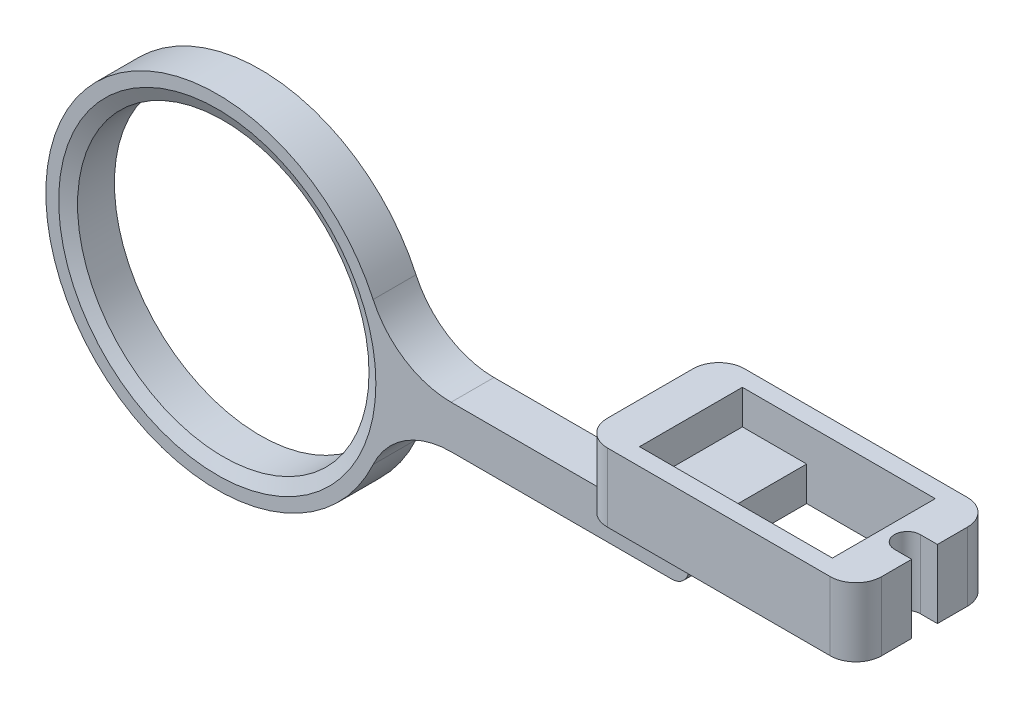
from build123d import *
from build123d.topology import SkipClean

# Parameters (mm, degrees)
BOSS_EXTRUDE1_DEPTH = 5
CHAMFER2_SIZE       = 1.5
CHAMFER2_SIZE2      = 0.699461487
FILLET1_R           = 10
SKETCH10_W          = 32
SKETCH10_H          = 5
BOSS_EXTRUDE3_DEPTH = 2
SKETCH5_W           = 32
SKETCH5_H           = 16
BOSS_EXTRUDE2_DEPTH = 8
SKETCH6_W           = 22.5
SKETCH6_H           = 12
CUT_EXTRUDE1_DEPTH  = 4
SKETCH7_W           = 25
SKETCH7_H           = 5
CUT_EXTRUDE2_DEPTH  = 7
SKETCH8_W           = 15
SKETCH8_H           = 12
CUT_EXTRUDE3_DEPTH  = 86.571607441
CUT_EXTRUDE4_DEPTH  = 85.32378075
FILLET2_R           = 2
FILLET3_START       = 48
FILLET3_DEPTH       = 6.9999999
FILLET3_START_2     = 47.322875556
FILLET3_2_DEPTH     = 9.677124544
FILLET3_START_3     = -3
FILLET3_3_DEPTH     = 10
FILLET4_R           = 3


with BuildPart() as part:
    # Sketch1 → Boss-Extrude1 (new body)
    with BuildSketch(Plane.XY):
        with BuildLine():
            ThreePointArc((16.815171721, -2.5), (-17, 0), (16.815171721, 2.5))
            Line((16.815171721, 2.5), (19.843134833, 2.5))
            ThreePointArc((19.843134833, 2.5), (-20, 0), (19.843134833, -2.5))
            Line((19.843134833, -2.5), (16.815171721, -2.5))
        make_face()
        with BuildLine():
            Line((19.843134833, 2.5), (16.815171721, 2.5))
            ThreePointArc((16.815171721, 2.5), (16.953729962, 1.253411494), (17, 0))
            ThreePointArc((17, 0), (16.953729962, -1.253411494), (16.815171721, -2.5))
            Line((16.815171721, -2.5), (19.843134833, -2.5))
            ThreePointArc((19.843134833, -2.5), (19.960745185, -1.252458251), (20, 0))
            ThreePointArc((20, 0), (19.960745185, 1.252458251), (19.843134833, 2.5))
        make_face()
        with BuildLine():
            Line((80, 2.5), (19.843134833, 2.5))
            ThreePointArc((19.843134833, 2.5), (19.960745185, 1.252458251), (20, 0))
            ThreePointArc((20, 0), (19.960745185, -1.252458251), (19.843134833, -2.5))
            Line((19.843134833, -2.5), (80, -2.5))
            Line((80, -2.5), (80, 2.5))
        make_face()
    extrude(amount=BOSS_EXTRUDE1_DEPTH)

    # Chamfer2
    chamfer2_edges = [part.edges().sort_by_distance(p)[0] for p in [
        (-16.815171721, -2.5, 5),
    ]]
    chamfer2_side = [part.faces().sort_by_distance(p)[0] for p in [
        (23.12129627, 0, 5),
    ]]
    chamfer(chamfer2_edges, length=CHAMFER2_SIZE, length2=CHAMFER2_SIZE2, reference=chamfer2_side[0])

    # Fillet1
    fillet1_edges = [part.edges().sort_by_distance(p)[0] for p in [
        (19.843134833, 2.5, 2.5),
        (19.843134833, -2.5, 2.5),
    ]]
    fillet(fillet1_edges, radius=FILLET1_R)

    # Sketch10 → Boss-Extrude3 (add)
    with BuildSketch(Plane(origin=(0, 2.5, 0), x_dir=(1, 0, 0), z_dir=(0, 1, 0))):
        with Locations((64, -2.5)):
            Rectangle(SKETCH10_W, SKETCH10_H)
    extrude(amount=BOSS_EXTRUDE3_DEPTH)

    # Sketch5 → Boss-Extrude2 (add)
    with BuildSketch(Plane(origin=(0, 4.5, 0), x_dir=(1, 0, 0), z_dir=(0, 1, 0))):
        with Locations((64, -2.5)):
            Rectangle(SKETCH5_W, SKETCH5_H)
    extrude(amount=BOSS_EXTRUDE2_DEPTH)

    # Sketch6 → Cut-Extrude1 (cut)
    with BuildSketch(Plane(origin=(0, 12.5, 0), x_dir=(1, 0, 0), z_dir=(0, 1, 0))):
        with Locations((64, -2.5)):
            Rectangle(SKETCH6_W, SKETCH6_H)
    extrude(amount=-CUT_EXTRUDE1_DEPTH, mode=Mode.SUBTRACT)

    # Sketch7 → Cut-Extrude2 (cut)
    with BuildSketch(Plane.XZ.offset(2.5)):
        with Locations((67.5, 2.5)):
            Rectangle(SKETCH7_W, SKETCH7_H)
    extrude(amount=-CUT_EXTRUDE2_DEPTH, mode=Mode.SUBTRACT)

    # Sketch8 → Cut-Extrude3 (cut, through all)
    with BuildSketch(Plane(origin=(0, 8.5, 0), x_dir=(1, 0, 0), z_dir=(0, 1, 0))):
        with Locations((67.75, -2.5)):
            Rectangle(SKETCH8_W, SKETCH8_H)
    extrude(amount=-CUT_EXTRUDE3_DEPTH, mode=Mode.SUBTRACT)

    # Sketch9 → Cut-Extrude4 (cut, through all)
    with BuildSketch(Plane.XZ.offset(-4.5)):
        with BuildLine():
            Line((78, 4), (80, 4))
            Line((80, 4), (80, 1))
            Line((80, 1), (78, 1))
            ThreePointArc((78, 1), (76.5, 2.5), (78, 4))
        make_face()
    extrude(amount=-CUT_EXTRUDE4_DEPTH, mode=Mode.SUBTRACT)

    # Fillet2
    fillet2_edges = [part.edges().sort_by_distance(p)[0] for p in [
        (55, 4.5, 2.5),
        (48, 2.5, 2.5),
        (55, -2.5, 2.5),
    ]]
    fillet(fillet2_edges, radius=FILLET2_R)

    # Fillet3: read off the stored shape, not the designer's step
    # Fillet3 outline → Fillet3 (add)
    with BuildSketch(Plane.YZ.offset(FILLET3_START)):
        with BuildLine():
            Line((4.5, -1.5), (4.5, 0))
            Line((4.5, 0), (3, 0))
            ThreePointArc((3, 0), (4.060660172, -0.439339828), (4.5, -1.5))
        make_face()
        with BuildLine():
            ThreePointArc((4.5, 6.5), (4.060660172, 5.439339828), (3, 5))
            Line((3, 5), (4.5, 5))
            Line((4.5, 5), (4.5, 6.5))
        make_face()
    extrude(amount=FILLET3_DEPTH)

    # Fillet3 2 outline → Fillet3 2 (add)
    with BuildSketch(Plane.YZ.offset(FILLET3_START_2)):
        with BuildLine():
            Line((4.5, -1.5), (4.5, 0))
            Line((4.5, 0), (3, 0))
            ThreePointArc((3, 0), (4.060660172, -0.439339828), (4.5, -1.5))
        make_face()
        with BuildLine():
            ThreePointArc((4.5, 6.5), (4.060660172, 5.439339828), (3, 5))
            Line((3, 5), (4.5, 5))
            Line((4.5, 5), (4.5, 6.5))
        make_face()
    extrude(amount=FILLET3_2_DEPTH)

    # Fillet3 3 outline → Fillet3 3 (cut)
    with SkipClean():  # the faces are left unmerged after this step: merging them gives an invalid solid
        with BuildSketch(Plane.XY.offset(FILLET3_START_3)):
            with BuildLine():
                Line((47.322875556, 4.5), (47.3228756, 2.999999951))
                ThreePointArc((47.3228756, 2.999999951), (47.82287564, 3.67712431), (48, 4.5))
                Line((48, 4.5), (47.322875556, 4.5))
            make_face()
            with BuildLine():
                ThreePointArc((57, 4.5), (55.775255129, 4.08113883), (55.063508327, 3))
                Line((55.063508327, 3), (57.0000001, 3))
                Line((57.0000001, 3), (57, 4.5))
            make_face()
        extrude(amount=FILLET3_3_DEPTH, mode=Mode.SUBTRACT)
    add(part.part.scale(1), mode=Mode.REPLACE)  # the faces are merged on a copy

    # Fillet4
    fillet4_edges = [part.edges().sort_by_distance(p)[0] for p in [
        (80, 8.5, 10.5),
        (80, 8.5, -5.5),
        (48, 8.5, -5.5),
        (48, 8.5, 10.5),
    ]]
    fillet(fillet4_edges, radius=FILLET4_R)


solid = part.part
